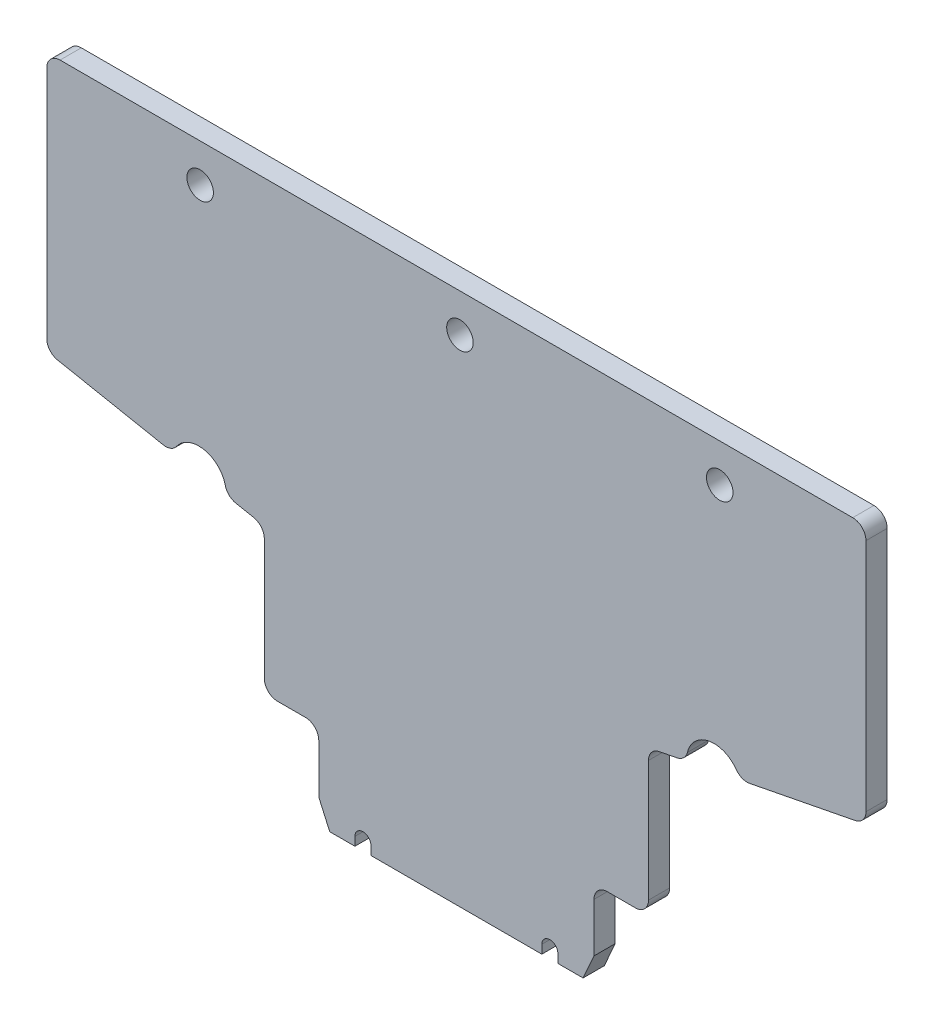
from build123d import *

# Parameters (mm, degrees)
SKETCH1_W           = 80
SKETCH1_H           = 60
BOSS_EXTRUDE1_DEPTH = 1.6
SKETCH2_OUTSIDE_W   = 102.002
SKETCH2_OUTSIDE_H   = 82.002
CUT_EXTRUDE1_DEPTH  = 1.6
FILLET1_R           = 1
SKETCH3_R           = 1
CUT_EXTRUDE2_DEPTH  = 10


with BuildPart() as part:
    # Sketch1 → Boss-Extrude1 (new body)
    with BuildSketch(Plane.XY):
        with Locations((40, 30)):
            Rectangle(SKETCH1_W, SKETCH1_H)
    extrude(amount=BOSS_EXTRUDE1_DEPTH)

    # Sketch2 outside → Cut-Extrude1 (cut)
    with BuildSketch(Plane.XY.offset(1.6)):
        with Locations((40, 30)):
            Rectangle(SKETCH2_OUTSIDE_W, SKETCH2_OUTSIDE_H)
        with BuildLine():
            Line((8.830524125, 49.648617791), (70.632878184, 49.648617791))
            Line((70.632878184, 49.648617791), (70.632878184, 30.112540158))
            Line((70.632878184, 30.112540158), (61.123106489, 28.255784683))
            ThreePointArc((61.123106489, 28.255784683), (58.77201565, 29.627241667), (57.109476194, 27.472134952))
            Line((57.109476194, 27.472134952), (54.224418996, 26.908835862))
            Line((54.224418996, 26.908835862), (54.224418996, 15.955223451))
            Line((54.224418996, 15.955223451), (50.114060899, 15.955223451))
            Line((50.114060899, 15.955223451), (50.114060899, 11.256501231))
            Line((50.114060899, 11.256501231), (49.289397665, 9.401008955))
            Line((49.289397665, 9.401008955), (47.389901446, 9.401008955))
            Line((47.389901446, 9.401008955), (47.389901446, 10.047799846))
            ThreePointArc((47.389901446, 10.047799846), (46.783221619, 10.654479673), (46.176541793, 10.047799846))
            Line((46.176541793, 10.047799846), (46.176541793, 9.401008955))
            Line((46.176541793, 9.401008955), (33.286860516, 9.401008955))
            Line((33.286860516, 9.401008955), (33.286860516, 10.047799846))
            ThreePointArc((33.286860516, 10.047799846), (32.68018069, 10.654479673), (32.073500863, 10.047799846))
            Line((32.073500863, 10.047799846), (32.073500863, 9.401008955))
            Line((32.073500863, 9.401008955), (30.174004644, 9.401008955))
            Line((30.174004644, 9.401008955), (29.34934141, 11.256501231))
            Line((29.34934141, 11.256501231), (29.34934141, 15.955223451))
            Line((29.34934141, 15.955223451), (25.238983313, 15.955223451))
            Line((25.238983313, 15.955223451), (25.238983313, 26.908835862))
            Line((25.238983313, 26.908835862), (22.353926115, 27.472134952))
            ThreePointArc((22.353926115, 27.472134952), (20.691386659, 29.627241667), (18.34029582, 28.255784683))
            Line((18.34029582, 28.255784683), (8.830524125, 30.112540158))
            Line((8.830524125, 30.112540158), (8.830524125, 49.648617791))
        make_face(mode=Mode.SUBTRACT)
    extrude(amount=-CUT_EXTRUDE1_DEPTH, mode=Mode.SUBTRACT)

    # Fillet1
    fillet1_edges = [part.edges().sort_by_distance(p)[0] for p in [
        (29.34934141, 15.955223451, 0.8),
        (18.34029582, 28.255784683, 0.8),
        (25.238983313, 26.908835862, 0.8),
        (22.353926115, 27.472134952, 0.8),
        (50.114060899, 15.955223451, 0.8),
        (54.224418996, 15.955223451, 0.8),
        (54.224418996, 26.908835862, 0.8),
        (57.109476194, 27.472134952, 0.8),
        (61.123106489, 28.255784683, 0.8),
        (70.632878184, 30.112540158, 0.8),
        (70.632878184, 49.648617791, 0.8),
        (8.830524125, 49.648617791, 0.8),
        (8.830524125, 30.112540158, 0.8),
        (25.238983313, 15.955223451, 0.8),
    ]]
    fillet(fillet1_edges, radius=FILLET1_R)

    # Sketch3 → Cut-Extrude2 (cut)
    with BuildSketch(Plane.XY.offset(1.6)):
        with Locations((20.4, 46.768617791)):
            Circle(SKETCH3_R)
        with Locations((40, 46.768617791)):
            Circle(SKETCH3_R)
        with Locations((59.6, 46.768617791)):
            Circle(SKETCH3_R)
    extrude(amount=-CUT_EXTRUDE2_DEPTH, mode=Mode.SUBTRACT)


solid = part.part
